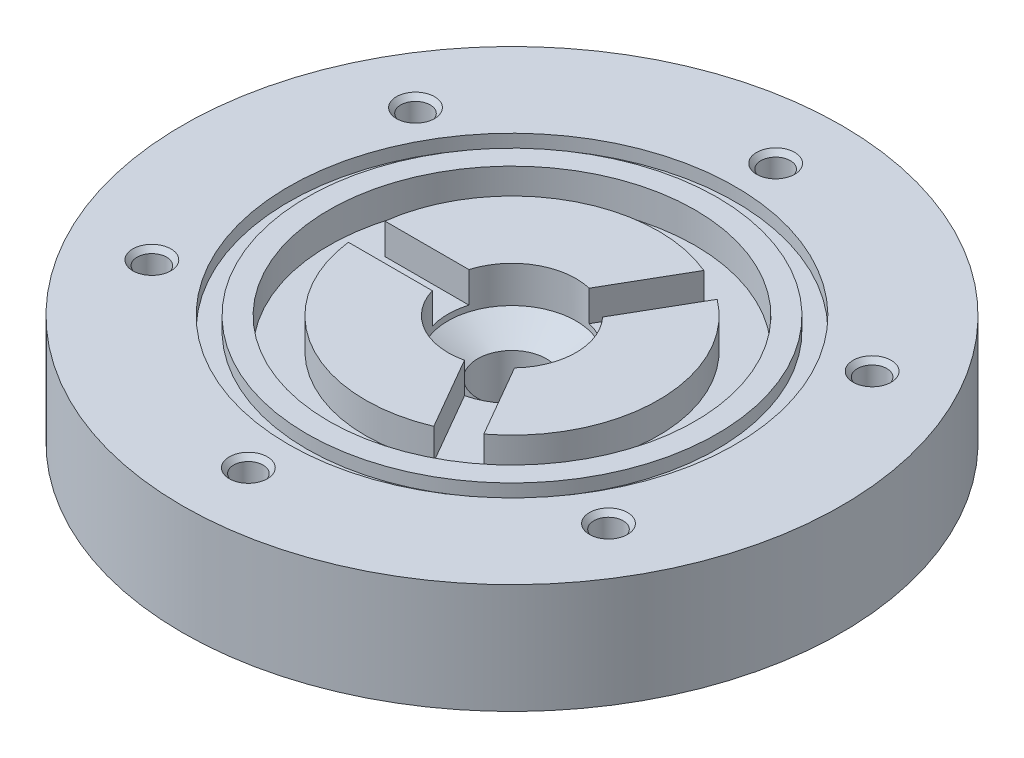
from build123d import *

# Parameters (mm, degrees)
SKETCH1_R                        = 57.15
BOSS_EXTRUDE1_DEPTH              = 19.05
F_7_8_0_875_DIAMETER_HOLE1_D     = 22.225
F_7_8_0_875_DIAMETER_HOLE1_DEPTH = 6.35
F_7_8_0_875_DIAMETER_HOLE1_TIP   = 6.677063629
CUT_EXTRUDE1_DEPTH               = 84.037024874
CUT_EXTRUDE1_DEPTH_BACK          = 84.037024874
SKETCH4_R                        = 5.953125
CUT_EXTRUDE3_START               = -5.334
SKETCH5_R                        = 31.75
CUT_EXTRUDE3_DEPTH               = 5.334
SKETCH7_R                        = 38.735
SKETCH7_R_2                      = 35.56
CUT_EXTRUDE5_DEPTH               = 2.286
CIRPATTERN1_COUNT                = 6


with BuildPart() as part:
    # Sketch1 → Boss-Extrude1 (new body)
    with BuildSketch(Plane(origin=(0, 0, 0), x_dir=(1, 0, 0), z_dir=(0, 1, 0))):
        Circle(SKETCH1_R)
    extrude(amount=BOSS_EXTRUDE1_DEPTH)

    # 7/8 (0.875) Diameter Hole1
    with Locations(Plane(origin=(0, 19.05, 0), x_dir=(1, 0, 0), z_dir=(0, 1, 0))):
        with Locations((0, 0)):
            Hole(F_7_8_0_875_DIAMETER_HOLE1_D / 2, depth=F_7_8_0_875_DIAMETER_HOLE1_DEPTH)
            with Locations((0, 0, -(F_7_8_0_875_DIAMETER_HOLE1_DEPTH + F_7_8_0_875_DIAMETER_HOLE1_TIP / 2))):  # 118° drill point
                Cone(0, F_7_8_0_875_DIAMETER_HOLE1_D / 2, F_7_8_0_875_DIAMETER_HOLE1_TIP, mode=Mode.SUBTRACT)

    # Sketch4 → Cut-Extrude1 (cut, two sides: drawn at the far end of the back side and taken through both)
    with BuildSketch(Plane(origin=(0, 19.05, 0), x_dir=(1, 0, 0), z_dir=(0, 1, 0)).offset(-CUT_EXTRUDE1_DEPTH_BACK)):
        Circle(SKETCH4_R)
    extrude(amount=CUT_EXTRUDE1_DEPTH + CUT_EXTRUDE1_DEPTH_BACK, mode=Mode.SUBTRACT)

    # Sketch5 → Cut-Extrude3 (cut)
    with BuildSketch(Plane(origin=(0, 19.05, 0), x_dir=(1, 0, 0), z_dir=(0, 1, 0)).offset(CUT_EXTRUDE3_START)):
        Circle(SKETCH5_R)
        with BuildLine():
            Line((-10.649273743, 3.175), (-25.200781238, 3.175))
            ThreePointArc((-25.200781238, 3.175), (-12.7, 21.997045256), (9.850759962, 23.412016747))
            Line((9.850759962, 23.412016747), (2.575006214, 10.810041593))
            ThreePointArc((2.575006214, 10.810041593), (5.55625, 9.6237073), (8.074267528, 7.635041593))
            Line((8.074267528, 7.635041593), (15.350021276, 20.237016747))
            ThreePointArc((15.350021276, 20.237016747), (25.4, 0), (15.350021276, -20.237016747))
            Line((15.350021276, -20.237016747), (8.074267528, -7.635041593))
            ThreePointArc((8.074267528, -7.635041593), (5.55625, -9.6237073), (2.575006214, -10.810041593))
            Line((2.575006214, -10.810041593), (9.850759962, -23.412016747))
            ThreePointArc((9.850759962, -23.412016747), (-12.7, -21.997045256), (-25.200781238, -3.175))
            Line((-25.200781238, -3.175), (-10.649273743, -3.175))
            ThreePointArc((-10.649273743, -3.175), (-11.1125, 0), (-10.649273743, 3.175))
        make_face(mode=Mode.SUBTRACT)
    extrude(amount=CUT_EXTRUDE3_DEPTH, mode=Mode.SUBTRACT)

    # Sketch7 → Cut-Extrude5 (cut)
    with BuildSketch(Plane(origin=(0, 19.05, 0), x_dir=(1, 0, 0), z_dir=(0, 1, 0))):
        Circle(SKETCH7_R)
        Circle(SKETCH7_R_2, mode=Mode.SUBTRACT)
    extrude(amount=-CUT_EXTRUDE5_DEPTH, mode=Mode.SUBTRACT)

    # Sketch9 → 1/4-20 Tapped Hole1 (revolve, cut)
    with BuildSketch(Plane(origin=(0, 19.05, -45.72), x_dir=(0, 0, 1), z_dir=(1, 0, 0))):
        Polygon((0, 0), (0, 15.503816902), (2.5527, 13.97), (2.5527, 0.861971048), (3.302, 0), align=None)
    f_1_4_20_tapped_hole1 = revolve(axis=Axis((0, 25.4, -45.72), (0, -1, 0)), mode=Mode.SUBTRACT)

    # CirPattern1: 1/4-20 Tapped Hole1 ×6 about axis
    cirpattern1_axis = Axis((0, 12.7, 0), (0, 1, 0))
    for i in range(1, CIRPATTERN1_COUNT):
        add(f_1_4_20_tapped_hole1.rotate(cirpattern1_axis, i * 360 / CIRPATTERN1_COUNT), mode=Mode.SUBTRACT)


solid = part.part
